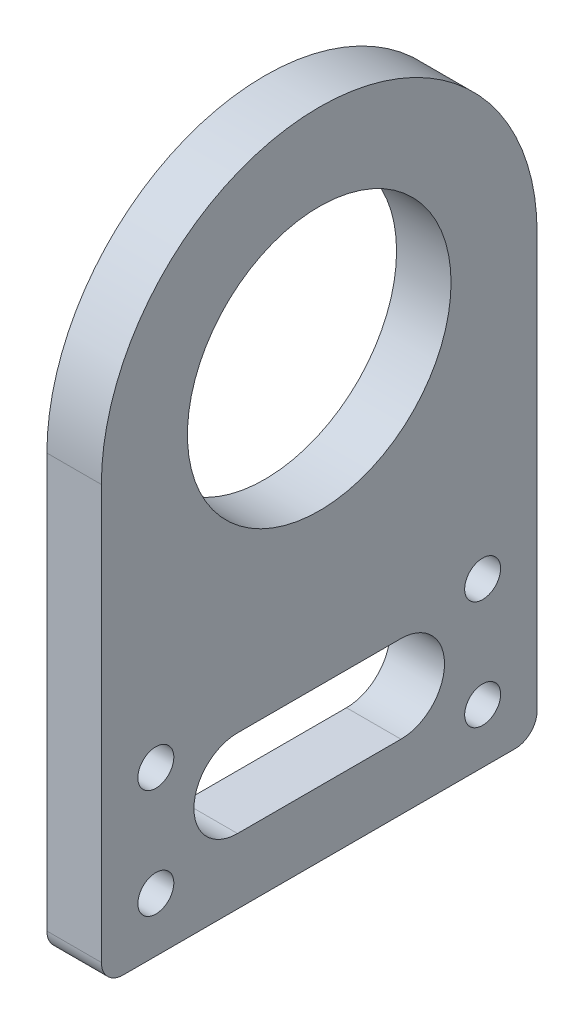
from build123d import *

# Parameters (mm, degrees)
SKETCH_1_R      = 12.1
SKETCH_1_R_2    = 1.65
EXTRUDE_1_DEPTH = 5
FILLET_1_R      = 2


with BuildPart() as part:
    # ｽｹｯﾁ1 → ﾎﾞｽ - 押し出し1 (new body)
    with BuildSketch(Plane(origin=(0, 0, 0), x_dir=(0, 0, -1), z_dir=(1, 0, 0))):
        with BuildLine():
            Line((-20, 0), (-20, -40))
            Line((-20, -40), (20, -40))
            Line((20, -40), (20, 0))
            ThreePointArc((20, 0), (0, 20), (-20, 0))
        make_face()
        Circle(SKETCH_1_R, mode=Mode.SUBTRACT)
        with Locations((15, -25)):
            Circle(SKETCH_1_R_2, mode=Mode.SUBTRACT)
        with Locations((15, -35)):
            Circle(SKETCH_1_R_2, mode=Mode.SUBTRACT)
        with Locations((-15, -25)):
            Circle(SKETCH_1_R_2, mode=Mode.SUBTRACT)
        with Locations((-15, -35)):
            Circle(SKETCH_1_R_2, mode=Mode.SUBTRACT)
        with BuildLine():
            Line((-7.5, -26), (7.5, -26))
            ThreePointArc((7.5, -26), (11.5, -30), (7.5, -34))
            Line((7.5, -34), (-7.5, -34))
            ThreePointArc((-7.5, -34), (-11.5, -30), (-7.5, -26))
        make_face(mode=Mode.SUBTRACT)
    extrude(amount=EXTRUDE_1_DEPTH)

    # ﾌｨﾚｯﾄ1
    fillet_1_edges = [part.edges().sort_by_distance(p)[0] for p in [
        (2.5, -40, -20),
        (2.5, -40, 20),
    ]]
    fillet(fillet_1_edges, radius=FILLET_1_R)


solid = part.part
